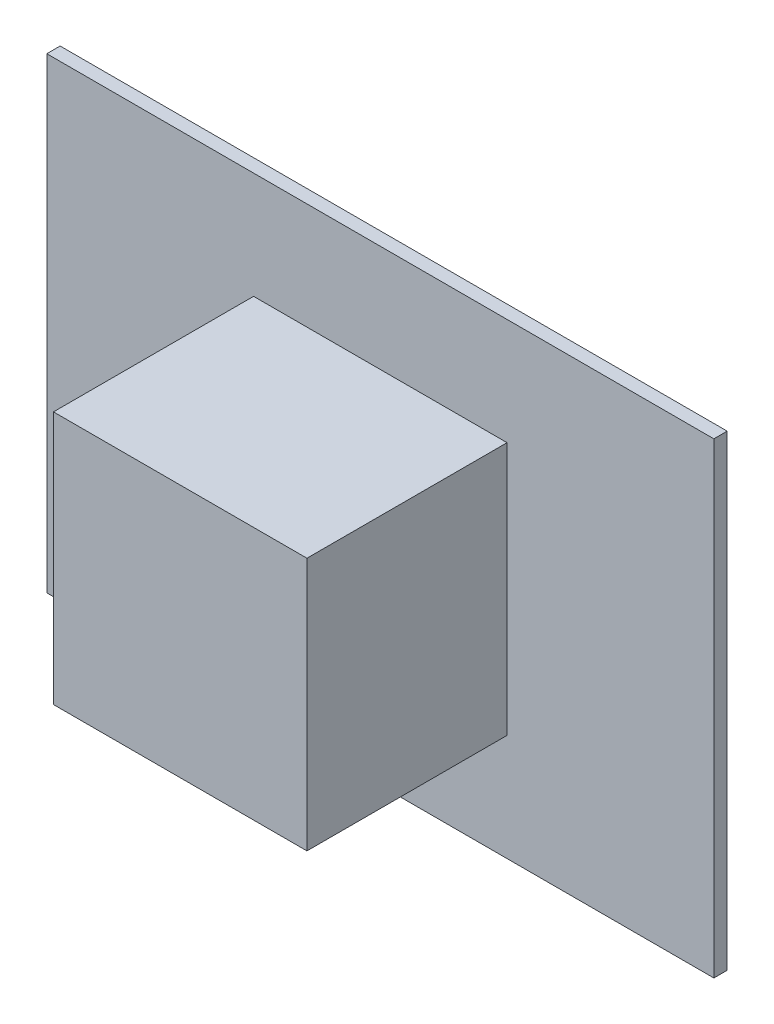
from build123d import *

# Parameters (mm, degrees)
SKETCH1_W           = 1.9
SKETCH1_H           = 1.9
BOSS_EXTRUDE1_DEPTH = 2
SKETCH4_W           = 5
SKETCH4_H           = 3.5
SKETCH4_W_2         = 1.530066542
SKETCH4_H_2         = 1.473797408
BOSS_EXTRUDE2_DEPTH = 0.1


with BuildPart() as part:
    # Sketch1 → Boss-Extrude1 (new body)
    with BuildSketch(Plane.XY):
        Rectangle(SKETCH1_W, SKETCH1_H)
    extrude(amount=BOSS_EXTRUDE1_DEPTH)

    # Sketch3 → Cut-Revolve1 (revolve, cut)
    with BuildSketch(Plane(origin=(0, 0, 0), x_dir=(0, 0, -1), z_dir=(1, 0, 0))):
        with BuildLine():
            Line((0, 0), (0, 0.7))
            Line((0, 0.7), (-0.972189278, 0.7))
            ThreePointArc((-0.972189278, 0.7), (-1.461166365, 0.49170934), (-1.662922441, 0))
            Line((-1.662922441, 0), (0, 0))
        make_face()
    revolve(axis=Axis((0, 0, 5.25), (0, 0, -1)), mode=Mode.SUBTRACT)

    # Sketch4 → Boss-Extrude2 (add)
    with BuildSketch(Plane.XY.offset(0.4)):
        Rectangle(SKETCH4_W, SKETCH4_H)
        Rectangle(SKETCH4_W_2, SKETCH4_H_2, mode=Mode.SUBTRACT)
    extrude(amount=BOSS_EXTRUDE2_DEPTH)


solid = part.part
